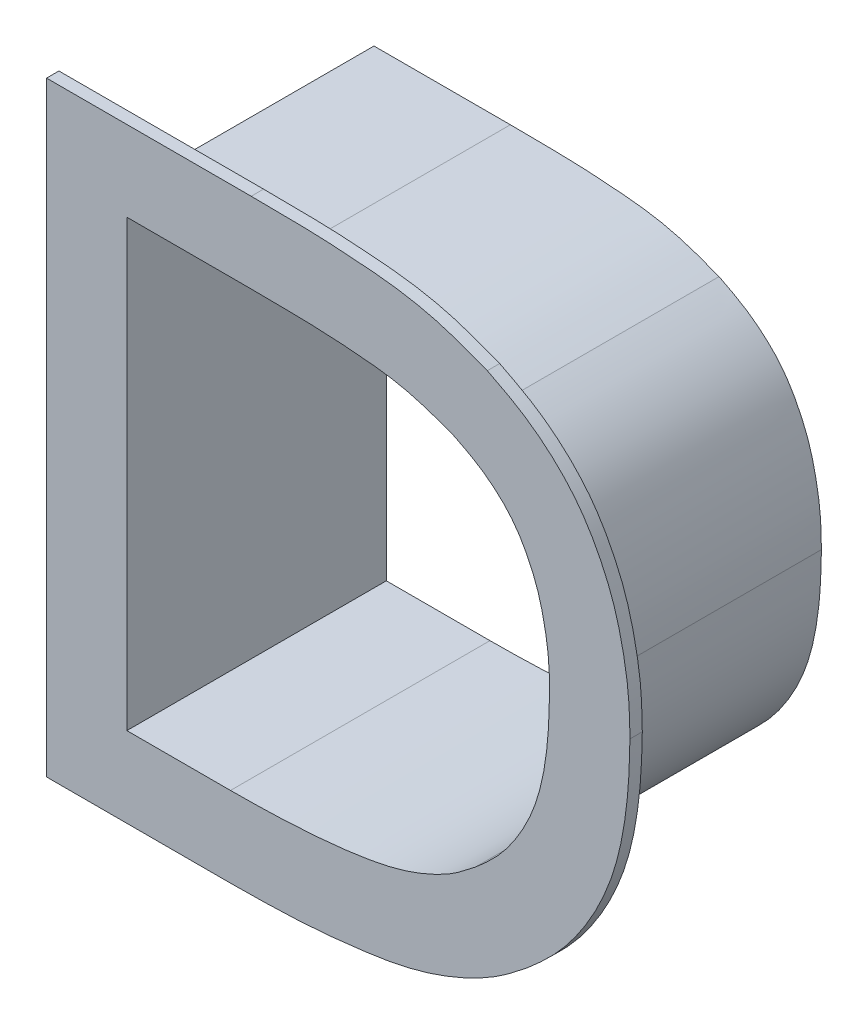
from build123d import *

# Parameters (mm, degrees)
BOSS_EXTRUDE1_DEPTH      = 1
BOSS_EXTRUDE1_DEPTH_BACK = 20
CUT_EXTRUDE1_START       = -20
CUT_EXTRUDE1_DEPTH       = 21
CUT_EXTRUDE2_DEPTH       = 20


with BuildPart() as part:
    # Sketch1 → Boss-Extrude1 (new, two sides: drawn at the far end of the back side and taken through both)
    with BuildSketch(Plane.XY.offset(-BOSS_EXTRUDE1_DEPTH_BACK)):
        with BuildLine():
            Line((2958.849681818, -1523.892686603), (2958.849681818, -1572.880046193))
            Line((2958.849681818, -1572.880046193), (2973.767827756, -1572.879891925))
            add(Edge.make_bspline(
                [(2973.767827756, -1572.879891925), (2975.872692571, -1572.860128702), (2977.97744433, -1572.837038501), (2981.128456873, -1572.622449637), (2982.176837562, -1572.520411147), (2984.266901408, -1572.279675791), (2985.310881123, -1572.151531628), (2987.385467262, -1571.796406217), (2988.418665053, -1571.564661717), (2990.42772202, -1570.970030606), (2991.407545952, -1570.607613705), (2992.843658133, -1569.975383258), (2993.316892991, -1569.750227353), (2994.249877125, -1569.26437839), (2994.710462552, -1569.002807433), (2995.600777329, -1568.440961858), (2996.03179999, -1568.139919647), (2996.874381171, -1567.510129893), (2997.286151137, -1567.181683323), (2997.698061708, -1566.853436892)],
                knots=[0, 0, 0, 0, 0.25, 0.25, 0.375, 0.375, 0.5, 0.5, 0.625, 0.625, 0.75, 0.75, 0.8125, 0.8125, 0.875, 0.875, 0.9375, 0.9375, 1, 1, 1, 1], degree=3))
            add(Edge.make_bspline(
                [(2997.698061708, -1566.853436892), (2998.416858499, -1566.231137048), (2999.132070809, -1565.605801223), (3000.439874878, -1564.251272502), (3001.040833723, -1563.529166355), (3001.870136359, -1562.384909745), (3002.134518134, -1561.99328271), (3002.639885881, -1561.190212879), (3002.88181464, -1560.777345774), (3003.56629642, -1559.520937412), (3003.965060607, -1558.663443678), (3004.645255929, -1556.907913122), (3004.925665177, -1556.009523199), (3005.375924175, -1554.174540788), (3005.547442261, -1553.235046422), (3005.815340161, -1551.349261322), (3005.909922946, -1550.403292778), (3006.024485076, -1548.505526326), (3006.044953808, -1547.553766658), (3006.065724013, -1546.602030546)],
                knots=[0, 0, 0, 0, 0.125, 0.125, 0.25, 0.25, 0.3125, 0.3125, 0.375, 0.375, 0.5, 0.5, 0.625, 0.625, 0.75, 0.75, 0.875, 0.875, 1, 1, 1, 1], degree=3))
            add(Edge.make_bspline(
                [(3006.065724013, -1546.602030546), (3006.04972175, -1545.577792039), (3006.031144664, -1544.554036514), (3005.843675505, -1542.534721285), (3005.678530811, -1541.538458655), (3005.265660908, -1539.561423704), (3005.017072922, -1538.580813221), (3004.349249805, -1536.651601947), (3003.927156281, -1535.69691585), (3002.976116906, -1533.87389373), (3002.441259888, -1533.000385871), (3001.502343695, -1531.777630592), (3001.167345475, -1531.384044934), (3000.455968626, -1530.623807652), (3000.085403132, -1530.263220064), (2998.936287392, -1529.230582402), (2998.119310629, -1528.608979786), (2996.812178732, -1527.783790373), (2996.362427394, -1527.526882528), (2995.447591339, -1527.034344288), (2994.984254165, -1526.799477811), (2994.521463917, -1526.563557737)],
                knots=[0, 0, 0, 0, 0.125, 0.125, 0.25, 0.25, 0.375, 0.375, 0.5, 0.5, 0.625, 0.625, 0.6875, 0.6875, 0.75, 0.75, 0.875, 0.875, 0.9375, 0.9375, 1, 1, 1, 1], degree=3))
            add(Edge.make_bspline(
                [(2994.521463917, -1526.563557737), (2993.765688091, -1526.272085638), (2993.010491549, -1525.978829783), (2991.483205477, -1525.44433573), (2990.710657636, -1525.204508785), (2989.138204589, -1524.809094938), (2988.339258152, -1524.653193843), (2986.738448585, -1524.406676163), (2985.933779187, -1524.317100974), (2984.722952021, -1524.212934338), (2984.318693535, -1524.183341594), (2983.509822186, -1524.126955112), (2983.105306438, -1524.099165519), (2981.891730085, -1524.019688984), (2981.082356745, -1523.977557139), (2979.462489648, -1523.931004115), (2978.652062316, -1523.924347209), (2977.031290954, -1523.90822966), (2976.220898612, -1523.900395057), (2975.410500017, -1523.892770911)],
                knots=[0, 0, 0, 0, 0.125, 0.125, 0.25, 0.25, 0.375, 0.375, 0.5, 0.5, 0.5625, 0.5625, 0.625, 0.625, 0.75, 0.75, 0.875, 0.875, 1, 1, 1, 1], degree=3))
            Line((2975.410500017, -1523.892770911), (2958.849681818, -1523.892686603))
        make_face()
    extrude(amount=BOSS_EXTRUDE1_DEPTH + BOSS_EXTRUDE1_DEPTH_BACK)

    # Cut-Extrude1: read off the stored shape, not the designer's step
    # Cut-Extrude1 outline → Cut-Extrude1 (cut)
    with BuildSketch(Plane.XY.offset(CUT_EXTRUDE1_START)):
        with BuildLine():
            add(Edge.make_bspline(
                [(2999.564611356, -1546.581932516), (2999.560199289, -1546.783286703), (2999.555713556, -1546.984640418), (2999.550951057, -1547.185992362), (2999.534489795, -1547.818236531), (2999.511294548, -1548.450437603), (2999.490831378, -1548.881110798), (2999.426611827, -1549.918234738), (2999.317611548, -1550.952232563), (2999.236483512, -1551.555232979), (2999.050783989, -1552.664033717), (2998.792033815, -1553.759793947), (2998.6557005, -1554.257958858), (2998.364859869, -1555.173667396), (2997.997352466, -1556.061024659), (2997.811925548, -1556.465364546), (2997.43514021, -1557.215812724), (2997.011924898, -1557.940652406), (2996.802455573, -1558.275235324), (2996.352584868, -1558.945006303), (2995.85768673, -1559.583161975), (2995.59297997, -1559.899565762), (2995.129592401, -1560.411063384), (2994.63189911, -1560.888356369), (2994.427352751, -1561.076325072), (2994.127451293, -1561.344110455), (2993.824926371, -1561.608514143), (2993.731268531, -1561.689977202), (2993.637497837, -1561.77129479), (2993.543683098, -1561.852555602)],
                knots=[0, 0, 0, 0, 0, 0, 0.059110167, 0.059110167, 0.059110167, 0.18560848, 0.18560848, 0.18560848, 0.363995279, 0.363995279, 0.363995279, 0.515214101, 0.515214101, 0.515214101, 0.645558691, 0.645558691, 0.645558691, 0.761279311, 0.761279311, 0.761279311, 0.882110137, 0.882110137, 0.882110137, 0.9635736, 0.9635736, 0.9635736, 1, 1, 1, 1, 1, 1], degree=5))
            add(Edge.make_bspline(
                [(2991.86894481, -1532.507311664), (2991.917727188, -1532.532220868), (2991.966502744, -1532.557143307), (2992.015269625, -1532.582082572), (2992.251762506, -1532.703149616), (2992.487964167, -1532.824781606), (2992.674876093, -1532.922484624), (2993.125152768, -1533.163819253), (2993.567139203, -1533.421165934), (2993.822697838, -1533.578813476), (2994.295211081, -1533.89045171), (2994.745988195, -1534.232754351), (2994.953066018, -1534.399748188), (2995.348862625, -1534.737107468), (2995.727539885, -1535.093636559), (2995.9075968, -1535.272751981), (2996.258392012, -1535.643974504), (2996.582901118, -1536.038753857), (2996.739291373, -1536.242815654), (2997.069559841, -1536.705108563), (2997.364851967, -1537.189961311), (2997.517596496, -1537.460995945), (2997.841182076, -1538.074085206), (2998.135390571, -1538.70208923), (2998.286730018, -1539.052742318), (2998.586377385, -1539.820367574), (2998.818630505, -1540.610699075), (2998.927804824, -1541.039958158), (2999.12917984, -1541.932899013), (2999.297418906, -1542.832012438), (2999.372220021, -1543.297429752), (2999.47290564, -1544.085611102), (2999.521569818, -1544.87895901), (2999.534967442, -1545.202600808), (2999.548302092, -1545.672889571), (2999.55740139, -1546.142922786), (2999.559941505, -1546.289267601), (2999.562305702, -1546.435601801), (2999.564611356, -1546.581932516)],
                knots=[0, 0, 0, 0, 0, 0, 0.016030085, 0.016030085, 0.016030085, 0.077753986, 0.077753986, 0.077753986, 0.16552737, 0.16552737, 0.16552737, 0.243297834, 0.243297834, 0.243297834, 0.317540058, 0.317540058, 0.317540058, 0.392660664, 0.392660664, 0.392660664, 0.483601528, 0.483601528, 0.483601528, 0.595188602, 0.595188602, 0.595188602, 0.724612519, 0.724612519, 0.724612519, 0.862455293, 0.862455293, 0.862455293, 0.957170285, 0.957170285, 0.957170285, 1, 1, 1, 1, 1, 1], degree=5))
            add(Edge.make_bspline(
                [(2975.379908678, -1530.392770753), (2975.635320758, -1530.395173553), (2975.890732771, -1530.397574462), (2976.146143794, -1530.399947135), (2976.8080658, -1530.40595474), (2977.469968724, -1530.411418814), (2977.87646884, -1530.415148123), (2978.89820325, -1530.426914914), (2979.920008426, -1530.448352542), (2980.53513518, -1530.466136469), (2981.684749787, -1530.511066357), (2982.832663167, -1530.582616061), (2983.366418547, -1530.621116564), (2984.420849653, -1530.706422764), (2985.4751468, -1530.807833622), (2985.994763952, -1530.86696457), (2987.032496202, -1531.013952985), (2988.056756518, -1531.238439658), (2988.566475319, -1531.3687841), (2989.402610593, -1531.61104315), (2990.225391079, -1531.892622818), (2990.549250324, -1532.008765811), (2991.007473299, -1532.178445738), (2991.464114808, -1532.351995365), (2991.599123107, -1532.403608526), (2991.734055949, -1532.455406322), (2991.86894481, -1532.507311664)],
                knots=[0, 0, 0, 0, 0, 0, 0.076276008, 0.076276008, 0.076276008, 0.197678027, 0.197678027, 0.197678027, 0.381415094, 0.381415094, 0.381415094, 0.541241886, 0.541241886, 0.541241886, 0.697238276, 0.697238276, 0.697238276, 0.854134567, 0.854134567, 0.854134567, 0.956840005, 0.956840005, 0.956840005, 1, 1, 1, 1, 1, 1], degree=5))
            Line((2975.379908678, -1530.392770753), (2965.349681818, -1530.392719693))
            Line((2965.349681818, -1530.392719693), (2965.349681818, -1566.379978977))
            Line((2965.349681818, -1566.379978977), (2973.737278623, -1566.379892232))
            add(Edge.make_bspline(
                [(2993.543683098, -1561.852555602), (2993.43705716, -1561.937476509), (2993.330365459, -1562.022326296), (2993.223495243, -1562.106982773), (2992.873649724, -1562.382327169), (2992.519497173, -1562.653007554), (2992.270493978, -1562.836218126), (2991.638235683, -1563.275868304), (2990.969618174, -1563.658432897), (2990.558800189, -1563.869767569), (2989.723512863, -1564.261411184), (2988.868115868, -1564.603636603), (2988.436564341, -1564.761316131), (2987.473782291, -1565.078900946), (2986.490169119, -1565.325293296), (2985.947414782, -1565.442190979), (2984.775432084, -1565.662090525), (2983.59668737, -1565.830917986), (2982.965373607, -1565.908917719), (2981.564927724, -1566.059879807), (2980.16092745, -1566.174319224), (2979.390132346, -1566.226249634), (2978.088344511, -1566.295874359), (2976.785464801, -1566.335549007), (2976.254518882, -1566.347735739), (2975.43246573, -1566.361982789), (2974.610416716, -1566.371460546), (2974.319370561, -1566.3744135), (2974.028324587, -1566.377158998), (2973.737278623, -1566.379892232)],
                knots=[0, 0, 0, 0, 0, 0, 0.03284736, 0.03284736, 0.03284736, 0.107235325, 0.107235325, 0.107235325, 0.218311088, 0.218311088, 0.218311088, 0.32891581, 0.32891581, 0.32891581, 0.462511465, 0.462511465, 0.462511465, 0.615777025, 0.615777025, 0.615777025, 0.801895391, 0.801895391, 0.801895391, 0.929861051, 0.929861051, 0.929861051, 1, 1, 1, 1, 1, 1], degree=5))
        make_face()
    extrude(amount=CUT_EXTRUDE1_DEPTH, mode=Mode.SUBTRACT)

    # Sketch2 → Cut-Extrude2 (cut)
    with BuildSketch(Plane(origin=(0, 0, -20), x_dir=(-1, 0, 0), z_dir=(0, 0, -1))):
        with BuildLine():
            Line((-2957.849681818, -1522.892681513), (-2975.419907498, -1522.892815162))
            add(Edge.make_bspline(
                [(-2975.419907498, -1522.892815162), (-2976.250334374, -1522.900627732), (-2977.080757395, -1522.908729242), (-2978.741600844, -1522.925126531), (-2979.572036658, -1522.932269269), (-2981.232420395, -1522.983118316), (-2982.061496977, -1523.02818346), (-2983.718289186, -1523.137727375), (-2984.546744697, -1523.191563766), (-2987.028279746, -1523.413413606), (-2988.662085857, -1523.652133805), (-2991.047633593, -1524.261413977), (-2991.832280311, -1524.506234688), (-2993.387380634, -1525.052088003), (-2994.158200037, -1525.351671856), (-2994.929550957, -1525.649150637)],
                knots=[0, 0, 0, 0, 0.125, 0.125, 0.25, 0.25, 0.375, 0.375, 0.5, 0.5, 0.75, 0.75, 0.875, 0.875, 1, 1, 1, 1], degree=3))
            add(Edge.make_bspline(
                [(-2994.929550957, -1525.649150637), (-2995.409232135, -1525.893681329), (-2995.889730359, -1526.137017698), (-2996.835714913, -1526.645634188), (-2997.301119322, -1526.911034055), (-2998.658245611, -1527.764369291), (-2999.511453788, -1528.408602358), (-3000.71686701, -1529.483705329), (-3001.108604608, -1529.862021994), (-3001.851318486, -1530.647739857), (-3002.202171297, -1531.054671595), (-3003.189581135, -1532.320180911), (-3003.756855155, -1533.226310201), (-3004.512885574, -1534.650624513), (-3004.750968055, -1535.13749972), (-3005.190118191, -1536.122972609), (-3005.3908103, -1536.620756117), (-3005.929075328, -1538.131162213), (-3006.199138362, -1539.161828937), (-3006.643661707, -1541.248715215), (-3006.823045805, -1542.305802987), (-3007.02935589, -1544.451457064), (-3007.049069381, -1545.528225293), (-3007.065894477, -1546.605129948)],
                knots=[0, 0, 0, 0, 0.0625, 0.0625, 0.125, 0.125, 0.25, 0.25, 0.3125, 0.3125, 0.375, 0.375, 0.5, 0.5, 0.5625, 0.5625, 0.625, 0.625, 0.75, 0.75, 0.875, 0.875, 1, 1, 1, 1], degree=3))
            add(Edge.make_bspline(
                [(-3007.065894477, -1546.605129948), (-3007.044456506, -1547.58746456), (-3007.023250298, -1548.569833279), (-3006.903650049, -1550.523211261), (-3006.805488623, -1551.494254756), (-3006.52981926, -1553.424664605), (-3006.354332297, -1554.384328378), (-3006.003932348, -1555.810995614), (-3005.872235213, -1556.284358998), (-3005.576811436, -1557.2263721), (-3005.412396416, -1557.69660213), (-3004.87476536, -1559.081940399), (-3004.457658857, -1559.975471603), (-3003.750003335, -1561.273813802), (-3003.500626365, -1561.699691216), (-3002.973960243, -1562.537164273), (-3002.695606216, -1562.94988624), (-3001.824010444, -1564.152822926), (-3001.193978684, -1564.90932261), (-2999.828664579, -1566.3246153), (-2999.084867353, -1566.975503732), (-2998.337199384, -1567.622798859)],
                knots=[0, 0, 0, 0, 0.125, 0.125, 0.25, 0.25, 0.375, 0.375, 0.4375, 0.4375, 0.5, 0.5, 0.625, 0.625, 0.6875, 0.6875, 0.75, 0.75, 0.875, 0.875, 1, 1, 1, 1], degree=3))
            add(Edge.make_bspline(
                [(-2998.337199384, -1567.622798859), (-2997.913365817, -1567.960545411), (-2997.489658147, -1568.298519089), (-2996.625716683, -1568.94465248), (-2996.185361463, -1569.252593133), (-2994.829537971, -1570.113710199), (-2993.879873151, -1570.605194306), (-2992.410454455, -1571.261379859), (-2991.912946257, -1571.466213641), (-2990.901256815, -1571.845802181), (-2990.385362373, -1572.021050891), (-2988.827863795, -1572.493428008), (-2987.774736228, -1572.736832692), (-2985.6459865, -1573.114913088), (-2984.569922437, -1573.250376528), (-2982.416450681, -1573.500248094), (-2981.338757126, -1573.608089569), (-2978.100277906, -1573.835251204), (-2975.934169133, -1573.859555227), (-2973.767838097, -1573.879891925)],
                knots=[0, 0, 0, 0, 0.0625, 0.0625, 0.125, 0.125, 0.25, 0.25, 0.3125, 0.3125, 0.375, 0.375, 0.5, 0.5, 0.625, 0.625, 0.75, 0.75, 1, 1, 1, 1], degree=3))
            Line((-2973.767838097, -1573.879891925), (-2957.849681818, -1573.880056534))
            Line((-2957.849681818, -1573.880056534), (-2957.849681818, -1522.892681513))
        make_face()
        with BuildLine():
            Line((-2973.737288965, -1567.379892231), (-2964.349681818, -1567.379989319))
            Line((-2964.349681818, -1567.379989319), (-2964.349681818, -1529.392714603))
            Line((-2964.349681818, -1529.392714603), (-2975.389315804, -1529.392815001))
            add(Edge.make_bspline(
                [(-2975.389315804, -1529.392815001), (-2976.106260535, -1529.399559689), (-2976.823215402, -1529.405491602), (-2978.257103741, -1529.419071074), (-2978.974019618, -1529.428129562), (-2980.407650434, -1529.462359736), (-2981.124104007, -1529.487237714), (-2982.555620066, -1529.561520806), (-2983.270715614, -1529.61085026), (-2984.699880583, -1529.728387246), (-2985.413805133, -1529.792501111), (-2986.828454417, -1529.974367331), (-2987.528277292, -1530.097123904), (-2988.908922426, -1530.423240118), (-2989.590563958, -1530.623124297), (-2990.940267727, -1531.080497783), (-2991.608857588, -1531.335748836), (-2992.277010257, -1531.592854518)],
                knots=[0, 0, 0, 0, 0.125, 0.125, 0.25, 0.25, 0.375, 0.375, 0.5, 0.5, 0.625, 0.625, 0.75, 0.75, 0.875, 0.875, 1, 1, 1, 1], degree=3))
            add(Edge.make_bspline(
                [(-2992.277010257, -1531.592854518), (-2992.955756651, -1531.939435253), (-2993.634043222, -1532.286654634), (-2994.59367389, -1532.887760624), (-2994.904398476, -1533.100840865), (-2995.504213394, -1533.557049018), (-2995.793962098, -1533.799262524), (-2996.355692286, -1534.308366315), (-2996.627469068, -1534.575540908), (-2997.146047797, -1535.144577483), (-2997.389727343, -1535.444346315), (-2998.062435015, -1536.370238882), (-2998.435296079, -1537.032021566), (-2999.105396536, -1538.400114352), (-2999.399895255, -1539.114773791), (-2999.850889981, -1540.565534506), (-3000.018354006, -1541.30270848), (-3000.307313274, -1542.78639827), (-3000.421613337, -1543.5343763), (-3000.541976558, -1545.052328418), (-3000.552730174, -1545.820003699), (-3000.564783968, -1546.585009656)],
                knots=[0, 0, 0, 0, 0.125, 0.125, 0.1875, 0.1875, 0.25, 0.25, 0.3125, 0.3125, 0.375, 0.375, 0.5, 0.5, 0.625, 0.625, 0.75, 0.75, 0.875, 0.875, 1, 1, 1, 1], degree=3))
            add(Edge.make_bspline(
                [(-3000.564783968, -1546.585009656), (-3000.548346381, -1547.335174442), (-3000.530105179, -1548.085230206), (-3000.452098136, -1549.582831723), (-3000.391892697, -1550.330350903), (-3000.206685187, -1551.821472543), (-3000.083351717, -1552.558989793), (-2999.762764878, -1554.010612062), (-2999.564870924, -1554.725107496), (-2999.066508249, -1556.123228981), (-2998.764721841, -1556.80645848), (-2998.064854081, -1558.143937976), (-2997.674913022, -1558.784960275), (-2996.817164397, -1559.997265575), (-2996.34861061, -1560.570531634), (-2995.316965243, -1561.638710254), (-2994.750135974, -1562.130524995), (-2994.18281326, -1562.621930766)],
                knots=[0, 0, 0, 0, 0.125, 0.125, 0.25, 0.25, 0.375, 0.375, 0.5, 0.5, 0.625, 0.625, 0.75, 0.75, 0.875, 0.875, 1, 1, 1, 1], degree=3))
            add(Edge.make_bspline(
                [(-2994.18281326, -1562.621930766), (-2993.481010256, -1563.180870752), (-2992.776811922, -1563.735482295), (-2991.263038474, -1564.6542859), (-2990.461988423, -1565.033883044), (-2989.222628157, -1565.534999618), (-2988.802120937, -1565.689208), (-2987.946202992, -1565.968578473), (-2987.515053252, -1566.091646221), (-2986.213257108, -1566.41737874), (-2985.334741874, -1566.57906271), (-2983.566858629, -1566.845909478), (-2982.676251584, -1566.948870539), (-2980.892432913, -1567.119662829), (-2979.999699152, -1567.187510135), (-2978.212640579, -1567.289337452), (-2977.318255963, -1567.322044433), (-2975.528325063, -1567.362731024), (-2974.632815117, -1567.371484112), (-2973.737288965, -1567.379892231)],
                knots=[0, 0, 0, 0, 0.125, 0.125, 0.25, 0.25, 0.3125, 0.3125, 0.375, 0.375, 0.5, 0.5, 0.625, 0.625, 0.75, 0.75, 0.875, 0.875, 1, 1, 1, 1], degree=3))
        make_face(mode=Mode.SUBTRACT)
    extrude(amount=-CUT_EXTRUDE2_DEPTH, mode=Mode.SUBTRACT)


solid = part.part
